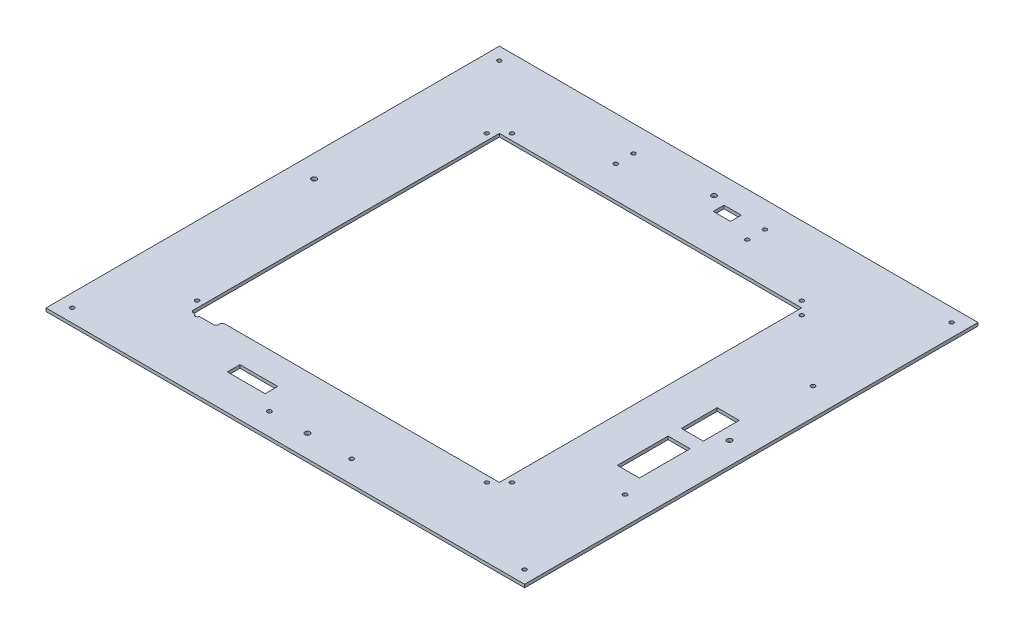
from build123d import *

# Parameters (mm, degrees)
SKETCH1_W           = 482.6
SKETCH1_H           = 457.2
SKETCH1_R           = 2
SKETCH1_W_2         = 38.1
SKETCH1_H_2         = 12.7
SKETCH1_R_2         = 2.1
SKETCH1_R_3         = 2.54
SKETCH1_R_4         = 2.0955
SKETCH1_W_3         = 22.197164078
SKETCH1_H_3         = 51.155633978
SKETCH1_H_4         = 36.225516101
SKETCH1_W_4         = 17.438820998
SKETCH1_H_5         = 10.883645004
BOSS_EXTRUDE1_DEPTH = 3.175
FILLET1_R           = 2.54


with BuildPart() as part:
    # Sketch1 → Boss-Extrude1 (new body)
    with BuildSketch(Plane(origin=(0, 0, 0), x_dir=(1, 0, 0), z_dir=(0, 1, 0))):
        with Locations((-1.251503591, 0)):
            Rectangle(SKETCH1_W, SKETCH1_H)
        with Locations((-229.375503591, -215.2716)):
            Circle(SKETCH1_R, mode=Mode.SUBTRACT)
        with Locations((-172.733503591, -146.082)):
            Circle(SKETCH1_R, mode=Mode.SUBTRACT)
        with Locations((-76.181503591, -186.695610311)):
            Rectangle(SKETCH1_W_2, SKETCH1_H_2, mode=Mode.SUBTRACT)
        with Locations((-39.643603591, -206.2861)):
            Circle(SKETCH1_R_2, mode=Mode.SUBTRACT)
        with Locations((-1.291503591, -206.2372)):
            Circle(SKETCH1_R_3, mode=Mode.SUBTRACT)
        with BuildLine():
            Line((-166.351503591, -152.4), (-166.351503591, 152.4))
            Line((-166.351503591, 152.4), (138.448496409, 152.4))
            Line((138.448496409, 152.4), (138.448496409, -152.4))
            Line((138.448496409, -152.4), (-140.951503591, -152.4))
            Line((-140.951503591, -152.4), (-140.951503591, -158.75))
            Line((-140.951503591, -158.75), (-158.033759607, -158.75))
            ThreePointArc((-158.033759607, -158.75), (-158.033567596, -158.765999488), (-158.033503591, -158.782))
            ThreePointArc((-158.033503591, -158.782), (-160.049504103, -160.781935995), (-162.033247575, -158.75))
            Line((-162.033247575, -158.75), (-166.351503591, -158.75))
            Line((-166.351503591, -158.75), (-166.351503591, -152.4))
        make_face(mode=Mode.SUBTRACT)
        with Locations((43.338196409, -206.2861)):
            Circle(SKETCH1_R_2, mode=Mode.SUBTRACT)
        with Locations((227.228096409, -215.9066)):
            Circle(SKETCH1_R, mode=Mode.SUBTRACT)
        with Locations((132.130496409, -158.782)):
            Circle(SKETCH1_R, mode=Mode.SUBTRACT)
        with Locations((144.830496409, -146.082)):
            Circle(SKETCH1_R, mode=Mode.SUBTRACT)
        with Locations((212.390436409, -99.579800078)):
            Circle(SKETCH1_R_4, mode=Mode.SUBTRACT)
        with Locations((194.083935921, -52.428980659)):
            Rectangle(SKETCH1_W_3, SKETCH1_H_3, mode=Mode.SUBTRACT)
        with Locations((-220.087103591, 19.264)):
            Circle(SKETCH1_R_3, mode=Mode.SUBTRACT)
        with Locations((-172.733503591, 146.082)):
            Circle(SKETCH1_R, mode=Mode.SUBTRACT)
        with Locations((-160.033503591, 158.782)):
            Circle(SKETCH1_R, mode=Mode.SUBTRACT)
        with Locations((-229.832703591, 215.8812)):
            Circle(SKETCH1_R, mode=Mode.SUBTRACT)
        with Locations((-81.109103591, 184.531)):
            Circle(SKETCH1_R, mode=Mode.SUBTRACT)
        with Locations((-81.109103591, 202.311)):
            Circle(SKETCH1_R, mode=Mode.SUBTRACT)
        with Locations((-3.831503591, 206.2626)):
            Circle(SKETCH1_R_3, mode=Mode.SUBTRACT)
        with Locations((194.083935921, 4.575109653)):
            Rectangle(SKETCH1_W_3, SKETCH1_H_4, mode=Mode.SUBTRACT)
        with Locations((217.711096409, 0.294)):
            Circle(SKETCH1_R_3, mode=Mode.SUBTRACT)
        with Locations((212.390436409, 89.827999922)):
            Circle(SKETCH1_R_4, mode=Mode.SUBTRACT)
        with Locations((18.318465636, 197.512214728)):
            Rectangle(SKETCH1_W_4, SKETCH1_H_5, mode=Mode.SUBTRACT)
        with Locations((51.351896409, 184.531)):
            Circle(SKETCH1_R, mode=Mode.SUBTRACT)
        with Locations((51.351896409, 202.311)):
            Circle(SKETCH1_R, mode=Mode.SUBTRACT)
        with Locations((144.830496409, 146.082)):
            Circle(SKETCH1_R, mode=Mode.SUBTRACT)
        with Locations((132.130496409, 158.782)):
            Circle(SKETCH1_R, mode=Mode.SUBTRACT)
        with Locations((226.720096409, 215.2716)):
            Circle(SKETCH1_R, mode=Mode.SUBTRACT)
    extrude(amount=BOSS_EXTRUDE1_DEPTH)

    # Fillet1
    fillet1_edges = [part.edges().sort_by_distance(p)[0] for p in [
        (-140.951503591, 1.5875, 158.75),
        (-166.351503591, 1.5875, 158.75),
        (-140.951503591, 1.5875, 152.4),
    ]]
    fillet(fillet1_edges, radius=FILLET1_R)


solid = part.part
